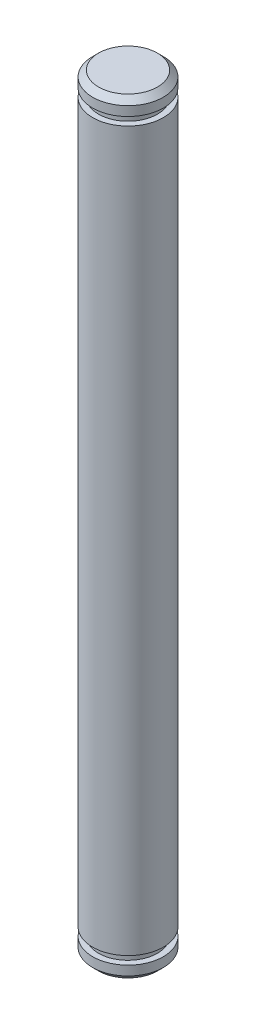
from build123d import *

# Parameters (mm, degrees)
SKETCH1_R          = 3
EXTRUDE_50_DEPTH   = 65
CUT_EXTRUDE1_START = -2
SKETCH2_R          = 3
SKETCH2_R_2        = 2.5
CUT_EXTRUDE1_DEPTH = 0.7
CUT_EXTRUDE2_START = -1.3
SKETCH3_R          = 3
SKETCH3_R_2        = 2.5
CUT_EXTRUDE2_DEPTH = 0.7
CHAMFER1_SIZE      = 0.5


with BuildPart() as part:
    # Sketch1 → Extrude 50 (new body)
    with BuildSketch(Plane(origin=(0, 0, 0), x_dir=(1, 0, 0), z_dir=(0, 1, 0))):
        Circle(SKETCH1_R)
    extrude(amount=EXTRUDE_50_DEPTH)

    # Sketch2 → Cut-Extrude1 (cut)
    with BuildSketch(Plane(origin=(0, 65, 0), x_dir=(1, 0, 0), z_dir=(0, 1, 0)).offset(CUT_EXTRUDE1_START)):
        Circle(SKETCH2_R)
        Circle(SKETCH2_R_2, mode=Mode.SUBTRACT)
    extrude(amount=CUT_EXTRUDE1_DEPTH, mode=Mode.SUBTRACT)

    # Sketch3 → Cut-Extrude2 (cut)
    with BuildSketch(Plane.XZ.offset(CUT_EXTRUDE2_START)):
        Circle(SKETCH3_R)
        Circle(SKETCH3_R_2, mode=Mode.SUBTRACT)
    extrude(amount=-CUT_EXTRUDE2_DEPTH, mode=Mode.SUBTRACT)

    # Chamfer1
    chamfer1_edges = [part.edges().sort_by_distance(p)[0] for p in [
        (-3, 65, 0),
        (-3, 0, 0),
    ]]
    chamfer(chamfer1_edges, length=CHAMFER1_SIZE)


solid = part.part
